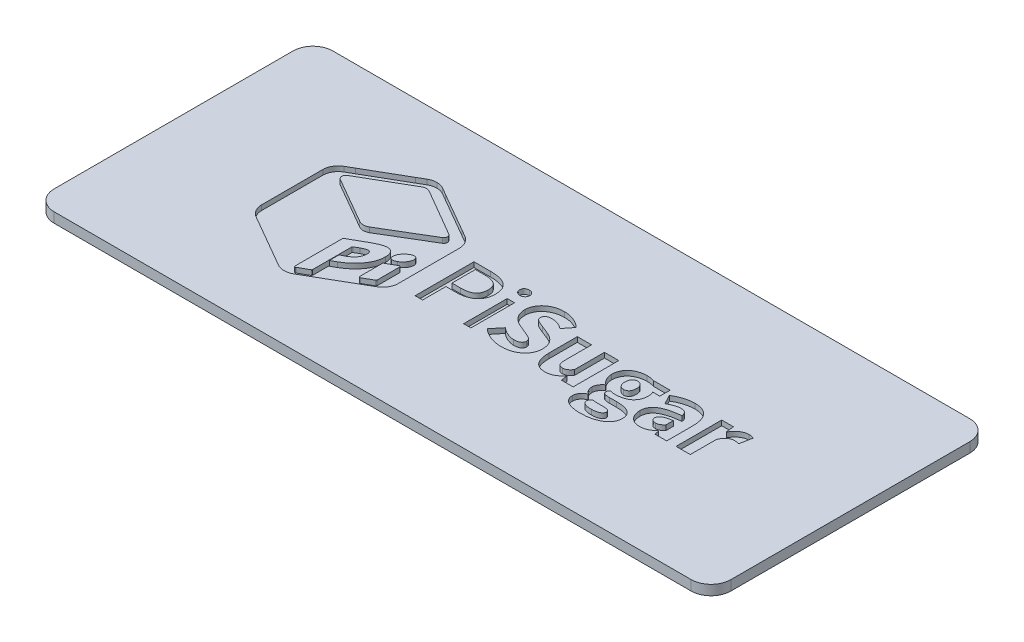
from build123d import *

# Parameters (mm, degrees)
EXTRUDE_1_DEPTH         = 1
CUT_EXTRUDE_START       = -0.5
CUT_EXTRUDE_1_OUTLINE_W = 0.73350715
CUT_EXTRUDE_1_OUTLINE_H = 4.379975541
CUT_EXTRUDE_1_DEPTH     = 0.5


# Read off the part's stored shape, not the designer's step: 切除-拉伸1
with BuildPart() as part:
    # 草图1 → 凸台-拉伸1 (new body)
    with BuildSketch(Plane(origin=(0, 0, 0), x_dir=(1, 0, 0), z_dir=(0, 1, 0))):
        with BuildLine():
            Line((-33.366834171, 14.778894472), (30.633165829, 14.778894472))
            ThreePointArc((30.633165829, 14.778894472), (32.047379392, 14.193108035), (32.633165829, 12.778894472))
            Line((32.633165829, 12.778894472), (32.633165829, -11.221105528))
            ThreePointArc((32.633165829, -11.221105528), (32.047379392, -12.63531909), (30.633165829, -13.221105528))
            Line((30.633165829, -13.221105528), (-33.366834171, -13.221105528))
            ThreePointArc((-33.366834171, -13.221105528), (-34.781047733, -12.63531909), (-35.366834171, -11.221105528))
            Line((-35.366834171, -11.221105528), (-35.366834171, 12.778894472))
            ThreePointArc((-35.366834171, 12.778894472), (-34.781047733, 14.193108035), (-33.366834171, 14.778894472))
        make_face()
    extrude(amount=EXTRUDE_1_DEPTH)

    # 切除-拉伸1 outline → 切除-拉伸1 (cut)
    # profile 1 of 9: a face of its own
    with BuildSketch(Plane(origin=(0, 1, 0), x_dir=(1, 0, 0), z_dir=(0, 1, 0)).offset(CUT_EXTRUDE_START)):
        with BuildLine():
            Line((-7.185333836, -0.041070775), (-6.205717382, -0.041070775))
            add(Edge.make_bspline(
                [(-6.205717382, -0.041070775), (-4.918386039, -0.041070775), (-4.031115356, 0.543587514), (-4.031115356, 1.789911074)],
                knots=[5, 5, 5, 5, 6, 6, 6, 6], degree=3))
            add(Edge.make_bspline(
                [(-4.031115356, 1.789911074), (-4.031115356, 3.082344912), (-4.918386039, 3.523413354), (-6.246787772, 3.523413354)],
                knots=[6, 6, 6, 6, 7, 7, 7, 7], degree=3))
            Line((-6.246787772, 3.523413354), (-7.934179775, 3.523413354))
            Line((-7.934179775, 3.523413354), (-7.934179775, -2.384931642))
            Line((-7.934179775, -2.384931642), (-7.185333836, -2.384931642))
            Line((-7.185333836, -2.384931642), (-7.185333836, -0.041070775))
        make_face()
        with BuildLine():
            add(Edge.make_bspline(
                [(-4.774764888, 1.789911074), (-4.774764888, 2.646410269), (-5.297911504, 2.91821987), (-6.333937136, 2.91821987)],
                knots=[3, 3, 3, 3, 4, 4, 4, 4], degree=3))
            add(Edge.make_bspline(
                [(-6.303134344, 0.564122709), (-5.26203752, 0.564122709), (-4.774764888, 0.943648174), (-4.774764888, 1.789911074)],
                knots=[4, 4, 4, 4, 5, 5, 5, 5], degree=3))
            Line((-6.303134344, 0.564122709), (-7.185333836, 0.564122709))
            Line((-7.185333836, 0.564122709), (-7.185333836, 2.91821987))
            Line((-7.185333836, 2.91821987), (-6.333937136, 2.91821987))
        make_face(mode=Mode.SUBTRACT)
    # profile 2 of 9: a face of its own
    with BuildSketch(Plane(origin=(0, 1, 0), x_dir=(1, 0, 0), z_dir=(0, 1, 0)).offset(CUT_EXTRUDE_START)):
        with BuildLine():
            add(Edge.make_bspline(
                [(-2.692508633, 2.897715979), (-2.40019514, 2.897715979), (-2.184763414, 3.097746308), (-2.184763414, 3.36955591), (-2.184763414, 3.672168304), (-2.40019514, 3.84652964), (-2.692508633, 3.84652964)],
                knots=[2, 2, 2, 2, 3, 3, 3, 4, 4, 4, 4], degree=3))
            add(Edge.make_bspline(
                [(-2.692508633, 3.84652964), (-2.984822125, 3.84652964), (-3.200253852, 3.672168304), (-3.200253852, 3.36955591), (-3.200253852, 3.097746308), (-2.984822125, 2.897715979), (-2.692508633, 2.897715979)],
                knots=[0, 0, 0, 0, 1, 1, 1, 2, 2, 2, 2], degree=3))
        make_face()
    # profile 3 of 9: a face of its own
    with BuildSketch(Plane(origin=(0, 1, 0), x_dir=(1, 0, 0), z_dir=(0, 1, 0)).offset(CUT_EXTRUDE_START)):
        with BuildLine():
            Line((1.90800113, 1.025695043), (1.159217799, 1.323173638))
            add(Edge.make_bspline(
                [(1.159217799, 1.323173638), (0.630937385, 1.533471565), (0.25141192, 1.66169132), (0.25141192, 1.995043899)],
                knots=[1, 1, 1, 1, 2, 2, 2, 2], degree=3))
            add(Edge.make_bspline(
                [(0.25141192, 1.995043899), (0.25141192, 2.313026386), (0.523252825, 2.492552824), (0.969455066, 2.492552824)],
                knots=[2, 2, 2, 2, 3, 3, 3, 3], degree=3))
            add(Edge.make_bspline(
                [(0.969455066, 2.492552824), (1.436129895, 2.492552824), (1.805450369, 2.333561581), (2.200314623, 2.030949187)],
                knots=[3, 3, 3, 3, 4, 4, 4, 4], degree=3))
            Line((2.200314623, 2.030949187), (2.918420376, 2.933621266))
            add(Edge.make_bspline(
                [(2.918420376, 2.933621266), (2.395273761, 3.461870377), (1.661829219, 3.728577483), (0.969455066, 3.728577483)],
                knots=[5, 5, 5, 5, 6, 6, 6, 6], degree=3))
            add(Edge.make_bspline(
                [(0.969455066, 3.728577483), (-0.307608679, 3.728577483), (-1.210280759, 2.91821987), (-1.210280759, 1.91299703)],
                knots=[6, 6, 6, 6, 7, 7, 7, 7], degree=3))
            add(Edge.make_bspline(
                [(-1.210280759, 1.91299703), (-1.210280759, 1.041096439), (-0.620519974, 0.517949824), (0.010373808, 0.266644114)],
                knots=[7, 7, 7, 7, 8, 8, 8, 8], degree=3))
            Line((0.010373808, 0.266644114), (0.774558535, -0.056472172))
            add(Edge.make_bspline(
                [(0.774558535, -0.056472172), (1.287437553, -0.271872594), (1.620821436, -0.384722256), (1.620821436, -0.733476231)],
                knots=[9, 9, 9, 9, 10, 10, 10, 10], degree=3))
            add(Edge.make_bspline(
                [(1.620821436, -0.733476231), (1.620821436, -1.056592517), (1.369515726, -1.256591543), (0.836101513, -1.256591543)],
                knots=[10, 10, 10, 10, 11, 11, 11, 11], degree=3))
            add(Edge.make_bspline(
                [(0.836101513, -1.256591543), (0.364292886, -1.256591543), (-0.194790321, -1.005285833), (-0.620519974, -0.641161765)],
                knots=[11, 11, 11, 11, 12, 12, 12, 12], degree=3))
            Line((-0.620519974, -0.641161765), (-1.435917475, -1.636148311))
            add(Edge.make_bspline(
                [(-1.435917475, -1.636148311), (-0.815353898, -2.205436508), (0.025712597, -2.497781304), (0.805298721, -2.497781304)],
                knots=[13, 13, 13, 13, 14, 14, 14, 14], degree=3))
            add(Edge.make_bspline(
                [(0.805298721, -2.497781304), (2.256786409, -2.497781304), (3.097852904, -1.620746915), (3.097852904, -0.62062657)],
                knots=[14, 14, 14, 14, 15, 15, 15, 15], degree=3))
            add(Edge.make_bspline(
                [(3.097852904, -0.62062657), (3.097852904, 0.225605027), (2.65171327, 0.728247751), (1.90800113, 1.025695043)],
                knots=[15, 15, 15, 15, 16, 16, 16, 16], degree=3))
        make_face()
    # profile 4 of 9: a face of its own
    with BuildSketch(Plane(origin=(0, 1, 0), x_dir=(1, 0, 0), z_dir=(0, 1, 0)).offset(CUT_EXTRUDE_START)):
        with BuildLine():
            Line((6.503439701, 2.200208028), (6.503439701, -0.805286807))
            add(Edge.make_bspline(
                [(6.503439701, -0.805286807), (6.262401589, -1.143773185), (6.062308651, -1.271992939), (5.739254973, -1.271992939)],
                knots=[1, 1, 1, 1, 2, 2, 2, 2], degree=3))
            add(Edge.make_bspline(
                [(5.739254973, -1.271992939), (5.375068298, -1.271992939), (5.205840761, -1.092497804), (5.205840761, -0.456501527)],
                knots=[2, 2, 2, 2, 3, 3, 3, 3], degree=3))
            Line((5.205840761, -0.456501527), (5.205840761, 2.200208028))
            Line((5.205840761, 2.200208028), (3.774888267, 2.200208028))
            Line((3.774888267, 2.200208028), (3.774888267, -0.636027966))
            add(Edge.make_bspline(
                [(3.774888267, -0.636027966), (3.774888267, -1.779738158), (4.20061792, -2.497781304), (5.200706962, -2.497781304)],
                knots=[6, 6, 6, 6, 7, 7, 7, 7], degree=3))
            add(Edge.make_bspline(
                [(5.200706962, -2.497781304), (5.826404338, -2.497781304), (6.25726779, -2.205436508), (6.636793254, -1.754100468)],
                knots=[7, 7, 7, 7, 8, 8, 8, 8], degree=3))
            Line((6.636793254, -1.754100468), (6.667533439, -1.754100468))
            Line((6.667533439, -1.754100468), (6.770146807, -2.384931642))
            Line((6.770146807, -2.384931642), (7.939463386, -2.384931642))
            Line((7.939463386, -2.384931642), (7.939463386, 2.200208028))
            Line((7.939463386, 2.200208028), (6.503439701, 2.200208028))
        make_face()
    # profile 5 of 9: a face of its own
    with BuildSketch(Plane(origin=(0, 1, 0), x_dir=(1, 0, 0), z_dir=(0, 1, 0)).offset(CUT_EXTRUDE_START)):
        with BuildLine():
            Line((21.20250727, 0.98468726), (21.443545382, 2.220711919))
            add(Edge.make_bspline(
                [(21.443545382, 2.220711919), (21.315325628, 2.277121098), (21.161499487, 2.313026386), (20.889658582, 2.313026386)],
                knots=[10, 10, 10, 10, 11, 11, 11, 11], degree=3))
            add(Edge.make_bspline(
                [(20.889658582, 2.313026386), (20.428054944, 2.313026386), (19.920309726, 2.01554779), (19.581854651, 1.405251811)],
                knots=[0, 0, 0, 0, 1, 1, 1, 1], degree=3))
            Line((19.581854651, 1.405251811), (19.551051859, 1.405251811))
            Line((19.551051859, 1.405251811), (19.453634897, 2.200208028))
            Line((19.453634897, 2.200208028), (18.284255711, 2.200208028))
            Line((18.284255711, 2.200208028), (18.284255711, -2.384931642))
            Line((18.284255711, -2.384931642), (19.710074406, -2.384931642))
            Line((19.710074406, -2.384931642), (19.710074406, 0.235872625))
            add(Edge.make_bspline(
                [(19.710074406, 0.235872625), (19.951112518, 0.841066109), (20.361440775, 1.056466532), (20.69989585, 1.056466532)],
                knots=[7, 7, 7, 7, 8, 8, 8, 8], degree=3))
            add(Edge.make_bspline(
                [(20.69989585, 1.056466532), (20.905059978, 1.056466532), (21.038413531, 1.025695043), (21.20250727, 0.98468726)],
                knots=[8, 8, 8, 8, 9, 9, 9, 9], degree=3))
        make_face()
    # profile 6 of 9: a face of its own
    with BuildSketch(Plane(origin=(0, 1, 0), x_dir=(1, 0, 0), z_dir=(0, 1, 0)).offset(CUT_EXTRUDE_START)):
        with BuildLine():
            Line((17.340513241, -2.384931642), (17.340513241, 0.220471229))
            add(Edge.make_bspline(
                [(17.340513241, 0.220471229), (17.340513241, 1.656557521), (16.668674284, 2.313026386), (15.483956309, 2.313026386)],
                knots=[11, 11, 11, 11, 12, 12, 12, 12], degree=3))
            add(Edge.make_bspline(
                [(15.483956309, 2.313026386), (14.770984354, 2.313026386), (14.114546793, 2.071988273), (13.509322005, 1.7129667)],
                knots=[0, 0, 0, 0, 1, 1, 1, 1], degree=3))
            Line((13.509322005, 1.7129667), (14.011933425, 0.769255534))
            add(Edge.make_bspline(
                [(14.011933425, 0.769255534), (14.468465871, 1.025695043), (14.847991335, 1.169316193), (15.212115404, 1.169316193)],
                knots=[2, 2, 2, 2, 3, 3, 3, 3], degree=3))
            add(Edge.make_bspline(
                [(15.212115404, 1.169316193), (15.678790232, 1.169316193), (15.873749371, 0.953915771), (15.904489556, 0.5846266)],
                knots=[3, 3, 3, 3, 4, 4, 4, 4], degree=3))
            add(Edge.make_bspline(
                [(15.904489556, 0.5846266), (14.114546793, 0.389730069), (13.355433257, -0.133385242), (13.355433257, -1.102734098)],
                knots=[4, 4, 4, 4, 5, 5, 5, 5], degree=3))
            add(Edge.make_bspline(
                [(13.355433257, -1.102734098), (13.355433257, -1.866918826), (13.873446073, -2.497781304), (14.719771581, -2.497781304)],
                knots=[5, 5, 5, 5, 6, 6, 6, 6], degree=3))
            add(Edge.make_bspline(
                [(14.719771581, -2.497781304), (15.2275168, -2.497781304), (15.653183846, -2.261845687), (16.03270931, -1.923359309)],
                knots=[6, 6, 6, 6, 7, 7, 7, 7], degree=3))
            Line((16.03270931, -1.923359309), (16.068583294, -1.923359309))
            Line((16.068583294, -1.923359309), (16.171134055, -2.384931642))
            Line((16.171134055, -2.384931642), (17.340513241, -2.384931642))
        make_face()
        with BuildLine():
            add(Edge.make_bspline(
                [(15.212115404, -1.384811297), (15.504428896, -1.384811297), (15.694191629, -1.246355249), (15.904489556, -1.020687229)],
                knots=[0, 0, 0, 0, 1, 1, 1, 1], degree=3))
            add(Edge.make_bspline(
                [(14.719771581, -0.98991574), (14.719771581, -1.256591543), (14.914605505, -1.384811297), (15.212115404, -1.384811297)],
                knots=[1, 1, 1, 1, 2, 2, 2, 2], degree=3))
            add(Edge.make_bspline(
                [(15.904489556, -0.28727399), (15.012085074, -0.410359946), (14.719771581, -0.666799455), (14.719771581, -0.98991574)],
                knots=[2, 2, 2, 2, 3, 3, 3, 3], degree=3))
            Line((15.904489556, -0.28727399), (15.904489556, -1.020687229))
        make_face(mode=Mode.SUBTRACT)
    # profile 7 of 9: a face of its own
    with BuildSketch(Plane(origin=(0, 1, 0), x_dir=(1, 0, 0), z_dir=(0, 1, 0)).offset(CUT_EXTRUDE_START)):
        with BuildLine():
            Line((11.406530554, -1.482259563), (10.683353609, -1.482259563))
            add(Edge.make_bspline(
                [(10.683353609, -1.482259563), (10.191009786, -1.482259563), (10.006380853, -1.384811297), (10.006380853, -1.174544674)],
                knots=[1, 1, 1, 1, 2, 2, 2, 2], degree=3))
            add(Edge.make_bspline(
                [(10.006380853, -1.174544674), (10.006380853, -1.020687229), (10.042254837, -0.948876654), (10.149939396, -0.851428388)],
                knots=[2, 2, 2, 2, 3, 3, 3, 3], degree=3))
            add(Edge.make_bspline(
                [(10.149939396, -0.851428388), (10.350032333, -0.907837567), (10.53459866, -0.933506561), (10.688487408, -0.933506561)],
                knots=[3, 3, 3, 3, 4, 4, 4, 4], degree=3))
            add(Edge.make_bspline(
                [(10.688487408, -0.933506561), (11.703977846, -0.933506561), (12.519500561, -0.466769125), (12.519500561, 0.605130492)],
                knots=[4, 4, 4, 4, 5, 5, 5, 5], degree=3))
            add(Edge.make_bspline(
                [(12.519500561, 0.605130492), (12.519500561, 0.825696017), (12.463028775, 1.03596264), (12.391280806, 1.164182395)],
                knots=[5, 5, 5, 5, 6, 6, 6, 6], degree=3))
            Line((12.391280806, 1.164182395), (13.098993748, 1.164182395))
            Line((13.098993748, 1.164182395), (13.098993748, 2.200208028))
            Line((13.098993748, 2.200208028), (11.416798152, 2.200208028))
            add(Edge.make_bspline(
                [(11.416798152, 2.200208028), (11.206500224, 2.277121098), (10.955194514, 2.313026386), (10.688487408, 2.313026386)],
                knots=[9, 9, 9, 9, 10, 10, 10, 10], degree=3))
            add(Edge.make_bspline(
                [(10.688487408, 2.313026386), (9.698665964, 2.313026386), (8.77032489, 1.769375879), (8.77032489, 0.646169578)],
                knots=[10, 10, 10, 10, 11, 11, 11, 11], degree=3))
            add(Edge.make_bspline(
                [(8.77032489, 0.646169578), (8.77032489, 0.112786669), (9.067834789, -0.31291168), (9.390888467, -0.5385797)],
                knots=[11, 11, 11, 11, 12, 12, 12, 12], degree=3))
            Line((9.390888467, -0.5385797), (9.390888467, -0.569351189))
            add(Edge.make_bspline(
                [(9.390888467, -0.569351189), (9.093441176, -0.779617813), (8.883143249, -1.102734098), (8.883143249, -1.425850384)],
                knots=[13, 13, 13, 13, 14, 14, 14, 14], degree=3))
            add(Edge.make_bspline(
                [(8.883143249, -1.425850384), (8.883143249, -1.810509647), (9.062700991, -2.051579063), (9.303739103, -2.215704105)],
                knots=[14, 14, 14, 14, 15, 15, 15, 15], degree=3))
            Line((9.303739103, -2.215704105), (9.303739103, -2.256711888))
            add(Edge.make_bspline(
                [(9.303739103, -2.256711888), (8.87800945, -2.472143614), (8.652372733, -2.779858503), (8.652372733, -3.159383968)],
                knots=[16, 16, 16, 16, 17, 17, 17, 17], degree=3))
            add(Edge.make_bspline(
                [(8.652372733, -3.159383968), (8.652372733, -3.979977874), (9.519108222, -4.313361757), (10.57566905, -4.313361757)],
                knots=[17, 17, 17, 17, 18, 18, 18, 18], degree=3))
            add(Edge.make_bspline(
                [(10.57566905, -4.313361757), (12.170715282, -4.313361757), (13.17086693, -3.626121404), (13.17086693, -2.656772548)],
                knots=[18, 18, 18, 18, 19, 19, 19, 19], degree=3))
            add(Edge.make_bspline(
                [(13.17086693, -2.656772548), (13.17086693, -1.825911043), (12.534901957, -1.482259563), (11.406530554, -1.482259563)],
                knots=[19, 19, 19, 19, 20, 20, 20, 20], degree=3))
        make_face()
        with BuildLine():
            add(Edge.make_bspline(
                [(10.801305766, -3.415823476), (11.391191765, -3.415823476), (11.801457415, -3.200423054), (11.801457415, -2.908078258)],
                knots=[5, 5, 5, 5, 6, 6, 6, 6], degree=3))
            add(Edge.make_bspline(
                [(9.826885718, -2.933715948), (9.826885718, -3.256832233), (10.211544981, -3.415823476), (10.801305766, -3.415823476)],
                knots=[0, 0, 0, 0, 1, 1, 1, 1], degree=3))
            add(Edge.make_bspline(
                [(10.042254837, -2.523418994), (9.898633686, -2.651638749), (9.826885718, -2.779858503), (9.826885718, -2.933715948)],
                knots=[1, 1, 1, 1, 2, 2, 2, 2], degree=3))
            add(Edge.make_bspline(
                [(10.698755005, -2.579828173), (10.36543373, -2.579828173), (10.191009786, -2.564458081), (10.042254837, -2.523418994)],
                knots=[2, 2, 2, 2, 3, 3, 3, 3], degree=3))
            Line((10.698755005, -2.579828173), (11.134752256, -2.579828173))
            add(Edge.make_bspline(
                [(11.801457415, -2.908078258), (11.801457415, -2.636237352), (11.560356695, -2.579828173), (11.134752256, -2.579828173)],
                knots=[4, 4, 4, 4, 5, 5, 5, 5], degree=3))
        make_face(mode=Mode.SUBTRACT)
        with BuildLine():
            add(Edge.make_bspline(
                [(10.688487408, -0.071842264), (11.02700509, -0.071842264), (11.268043202, 0.169195848), (11.268043202, 0.646169578), (11.268043202, 1.112907014), (11.02700509, 1.353945127), (10.688487408, 1.353945127)],
                knots=[0, 0, 0, 0, 1, 1, 1, 2, 2, 2, 2], degree=3))
            add(Edge.make_bspline(
                [(10.688487408, 1.353945127), (10.360299931, 1.353945127), (10.108994221, 1.112907014), (10.108994221, 0.646169578), (10.108994221, 0.169195848), (10.360299931, -0.071842264), (10.688487408, -0.071842264)],
                knots=[2, 2, 2, 2, 3, 3, 3, 4, 4, 4, 4], degree=3))
        make_face(mode=Mode.SUBTRACT)
    # profile 8 of 9: a face of its own
    with BuildSketch(Plane(origin=(0, 1, 0), x_dir=(1, 0, 0), z_dir=(0, 1, 0)).offset(CUT_EXTRUDE_START)):
        with BuildLine():
            Line((-15.18623399, 7.92905789), (-15.924749724, 8.359890038))
            add(Edge.make_bspline(
                [(-15.924749724, 8.359890038), (-16.165850443, 8.493212288), (-16.432494942, 8.565022863), (-16.699202049, 8.565022863)],
                knots=[3, 3, 3, 3, 4, 4, 4, 4], degree=3))
            add(Edge.make_bspline(
                [(-16.699202049, 8.565022863), (-16.965909155, 8.565022863), (-17.232616262, 8.493212288), (-17.473654374, 8.359890038)],
                knots=[4, 4, 4, 4, 5, 5, 5, 5], degree=3))
            Line((-17.473654374, 8.359890038), (-18.212232715, 7.92905789))
            Line((-18.212232715, 7.92905789), (-22.043423951, 5.718550576))
            Line((-22.043423951, 5.718550576), (-22.782002293, 5.292852226))
            add(Edge.make_bspline(
                [(-22.782002293, 5.292852226), (-23.258944719, 5.015908826), (-23.556454618, 4.503029808), (-23.556454618, 3.954245503)],
                knots=[8, 8, 8, 8, 9, 9, 9, 9], degree=3))
            Line((-23.556454618, 3.954245503), (-23.556454618, -2.179798818))
            add(Edge.make_bspline(
                [(-23.556454618, -2.179798818), (-23.556454618, -2.733685618), (-23.258944719, -3.241462141), (-22.782002293, -3.518405541)],
                knots=[10, 10, 10, 10, 11, 11, 11, 11], degree=3))
            Line((-22.782002293, -3.518405541), (-22.043423951, -3.94410389))
            Line((-22.043423951, -3.94410389), (-18.212232715, -6.154611204))
            Line((-18.212232715, -6.154611204), (-17.473654374, -6.585412049))
            add(Edge.make_bspline(
                [(-17.473654374, -6.585412049), (-17.232616262, -6.723899401), (-16.965909155, -6.790576178), (-16.699202049, -6.790576178)],
                knots=[14, 14, 14, 14, 15, 15, 15, 15], degree=3))
            add(Edge.make_bspline(
                [(-16.699202049, -6.790576178), (-16.432494942, -6.790576178), (-16.165850443, -6.723899401), (-15.924749724, -6.585412049)],
                knots=[15, 15, 15, 15, 16, 16, 16, 16], degree=3))
            Line((-15.924749724, -6.585412049), (-15.18623399, -6.154611204))
            Line((-15.18623399, -6.154611204), (-11.355042754, -3.94410389))
            Line((-11.355042754, -3.94410389), (-10.61652702, -3.518405541))
            add(Edge.make_bspline(
                [(-10.61652702, -3.518405541), (-10.134388187, -3.241462141), (-9.842074694, -2.733685618), (-9.842074694, -2.179798818)],
                knots=[19, 19, 19, 19, 20, 20, 20, 20], degree=3))
            Line((-9.842074694, -2.179798818), (-9.842074694, 3.954245503))
            add(Edge.make_bspline(
                [(-9.842074694, 3.954245503), (-9.842074694, 4.503029808), (-10.134388187, 5.015908826), (-10.61652702, 5.292852226)],
                knots=[21, 21, 21, 21, 22, 22, 22, 22], degree=3))
            Line((-10.61652702, 5.292852226), (-11.355042754, 5.718550576))
            Line((-11.355042754, 5.718550576), (-15.18623399, 7.92905789))
        make_face()
        with BuildLine():
            add(Edge.make_bspline(
                [(-13.975847021, -1.174544674), (-13.975847021, -1.661786001), (-14.252759117, -2.092586846), (-14.837511318, -2.42083693)],
                knots=[0, 0, 0, 0, 1, 1, 1, 1], degree=3))
            add(Edge.make_bspline(
                [(-14.868251503, -1.005285833), (-14.293829508, -0.677067052), (-13.975847021, -0.671933253), (-13.975847021, -1.174544674)],
                knots=[6, 6, 6, 6, 7, 7, 7, 7], degree=3))
            Line((-14.868251503, -1.005285833), (-15.309319945, -1.251489048))
            add(Edge.make_bspline(
                [(-15.360657933, -1.338669716), (-15.360657933, -1.302764428), (-15.340122738, -1.26685914), (-15.309319945, -1.251489048)],
                knots=[4, 4, 4, 4, 5, 5, 5, 5], degree=3))
            Line((-15.360657933, -1.338669716), (-15.360657933, -5.257072923))
            add(Edge.make_bspline(
                [(-15.411870706, -5.344253591), (-15.375996722, -5.3237497), (-15.360657933, -5.292978211), (-15.360657933, -5.257072923)],
                knots=[3, 3, 3, 3, 4, 4, 4, 4], degree=3))
            Line((-15.411870706, -5.344253591), (-16.406888556, -5.908407989))
            add(Edge.make_bspline(
                [(-16.555643505, -5.821227321), (-16.555643505, -5.898171695), (-16.473565333, -5.944313277), (-16.406888556, -5.908407989)],
                knots=[5, 5, 5, 5, 6, 6, 6, 6], degree=3))
            Line((-16.555643505, -5.821227321), (-16.555643505, -1.071962609))
            add(Edge.make_bspline(
                [(-16.504368125, -0.984781941), (-16.540242109, -1.000152034), (-16.555643505, -1.036057322), (-16.555643505, -1.071962609)],
                knots=[7, 7, 7, 7, 8, 8, 8, 8], degree=3))
            Line((-16.504368125, -0.984781941), (-14.811842324, -0.025700683))
            add(Edge.make_bspline(
                [(-12.806530442, -0.51294201), (-12.806530442, 0.717980154), (-13.714273713, 0.594894198), (-14.811842324, -0.025700683)],
                knots=[9, 9, 9, 9, 10, 10, 10, 10], degree=3))
            add(Edge.make_bspline(
                [(-14.775905733, -3.333776607), (-13.724541311, -2.738819417), (-12.806530442, -1.697691289), (-12.806530442, -0.51294201)],
                knots=[10, 10, 10, 10, 11, 11, 11, 11], degree=3))
            Line((-14.775905733, -3.333776607), (-15.309319945, -3.631223899))
            Line((-15.309319945, -3.631223899), (-15.309319945, -2.656772548))
            Line((-15.309319945, -2.656772548), (-14.837511318, -2.42083693))
        make_face(mode=Mode.SUBTRACT)
        with BuildLine():
            add(Edge.make_bspline(
                [(-11.262759591, -3.015794121), (-11.231956798, -3.000392724), (-11.211421603, -2.964487437), (-11.211421603, -2.928582149)],
                knots=[0, 0, 0, 0, 1, 1, 1, 1], degree=3))
            Line((-11.262759591, -3.015794121), (-12.247447236, -3.57481472))
            add(Edge.make_bspline(
                [(-12.396202185, -3.487634052), (-12.396202185, -3.564547122), (-12.314124012, -3.610720007), (-12.247447236, -3.57481472)],
                knots=[2, 2, 2, 2, 3, 3, 3, 3], degree=3))
            Line((-12.396202185, -3.487634052), (-12.396202185, -1.225820054))
            add(Edge.make_bspline(
                [(-12.344864198, -1.138639386), (-12.37566699, -1.159143277), (-12.396202185, -1.18994607), (-12.396202185, -1.225820054)],
                knots=[4, 4, 4, 4, 5, 5, 5, 5], degree=3))
            Line((-12.344864198, -1.138639386), (-11.360176552, -0.584721282))
            add(Edge.make_bspline(
                [(-11.211421603, -0.671933253), (-11.211421603, -0.594988879), (-11.293499776, -0.548847298), (-11.360176552, -0.584721282)],
                knots=[6, 6, 6, 6, 7, 7, 7, 7], degree=3))
            Line((-11.211421603, -0.671933253), (-11.211421603, -2.928582149))
        make_face(mode=Mode.SUBTRACT)
        with BuildLine():
            add(Edge.make_bspline(
                [(-11.801244995, 0.918010483), (-12.201243047, 0.692342463), (-12.48335155, 0.28204551), (-12.48335155, -0.082109862), (-12.48335155, -0.435997636), (-12.201243047, -0.533445902), (-11.801244995, -0.302644083)],
                knots=[0, 0, 0, 0, 1, 1, 1, 2, 2, 2, 2], degree=3))
            add(Edge.make_bspline(
                [(-11.801244995, -0.302644083), (-11.406318134, -0.082109862), (-11.124272239, 0.33332089), (-11.124272239, 0.687208665), (-11.124272239, 1.046230238), (-11.406318134, 1.143678503), (-11.801244995, 0.918010483)],
                knots=[2, 2, 2, 2, 3, 3, 3, 4, 4, 4, 4], degree=3))
        make_face(mode=Mode.SUBTRACT)
        with BuildLine():
            add(Edge.make_bspline(
                [(-17.196742278, 1.307803545), (-16.889027388, 1.128277107), (-16.504368125, 1.128277107), (-16.196590629, 1.307803545)],
                knots=[7, 7, 7, 7, 8, 8, 8, 8], degree=3))
            add(Edge.make_bspline(
                [(-21.843393622, 3.990150791), (-21.833126024, 3.985016992), (-17.196742278, 1.307803545)],
                knots=[0, 0, 0, 1, 1, 1], degree=2))
            add(Edge.make_bspline(
                [(-21.79725204, 4.682524943), (-22.058825348, 4.533801297), (-22.084431734, 4.164512127), (-21.843393622, 3.990150791)],
                knots=[1, 1, 1, 1, 2, 2, 2, 2], degree=3))
            Line((-21.79725204, 4.682524943), (-17.058254926, 7.421312671))
            add(Edge.make_bspline(
                [(-16.335077981, 7.421312671), (-16.560714697, 7.549532425), (-16.837689401, 7.549532425), (-17.058254926, 7.421312671)],
                knots=[3, 3, 3, 3, 4, 4, 4, 4], degree=3))
            Line((-16.335077981, 7.421312671), (-11.62174986, 4.677391144))
            add(Edge.make_bspline(
                [(-11.616616061, 4.04655997), (-11.375577949, 4.19018112), (-11.380711747, 4.538935096), (-11.62174986, 4.677391144)],
                knots=[5, 5, 5, 5, 6, 6, 6, 6], degree=3))
            Line((-11.616616061, 4.04655997), (-16.196590629, 1.307803545))
        make_face(mode=Mode.SUBTRACT)
    # profile 9 of 9: a face of its own
    with BuildSketch(Plane(origin=(0, 1, 0), x_dir=(1, 0, 0), z_dir=(0, 1, 0)).offset(CUT_EXTRUDE_START)):
        with Locations((-2.695075532, -0.194943872)):
            Rectangle(CUT_EXTRUDE_1_OUTLINE_W, CUT_EXTRUDE_1_OUTLINE_H)
    extrude(amount=CUT_EXTRUDE_1_DEPTH, mode=Mode.SUBTRACT)


solid = part.part
